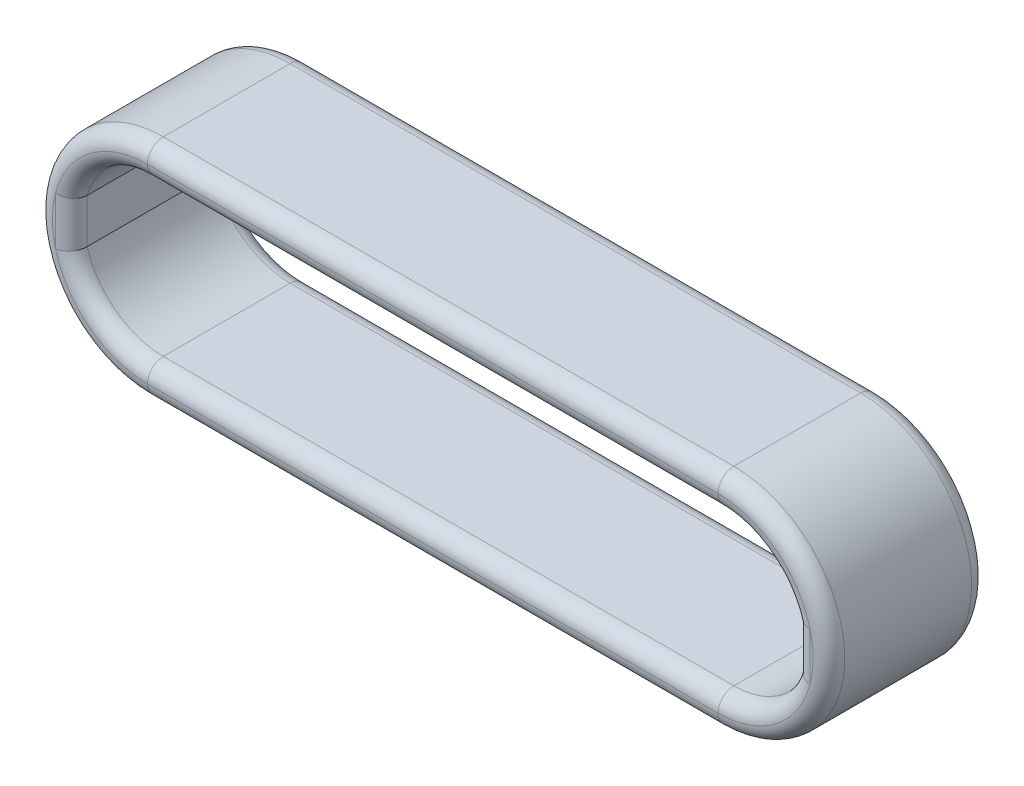
from build123d import *

# Parameters (mm, degrees)
BOSS_EXTRUDE1_DEPTH = 5
FILLET1_R           = 0.5


with BuildPart() as part:
    # Sketch1 → Boss-Extrude1 (new body)
    with BuildSketch(Plane.XY):
        with BuildLine():
            Line((-9, 3.5), (9, 3.5))
            ThreePointArc((9, 3.5), (12.5, 0), (9, -3.5))
            Line((9, -3.5), (-9, -3.5))
            ThreePointArc((-9, -3.5), (-12.5, 0), (-9, 3.5))
        make_face()
        with BuildLine():
            Line((-9, 2.5), (9, 2.5))
            ThreePointArc((9, 2.5), (10.5, 2), (11.4, 0.7))
            Line((11.4, 0.7), (11.4, -0.7))
            ThreePointArc((11.4, -0.7), (10.5, -2), (9, -2.5))
            Line((9, -2.5), (-9, -2.5))
            ThreePointArc((-9, -2.5), (-10.5, -2), (-11.4, -0.7))
            Line((-11.4, -0.7), (-11.4, 0.7))
            ThreePointArc((-11.4, 0.7), (-10.5, 2), (-9, 2.5))
        make_face(mode=Mode.SUBTRACT)
    extrude(amount=BOSS_EXTRUDE1_DEPTH)

    # Fillet1
    # the kernel refuses this fillet: 0.5 mm, written as the material it takes off along each edge
    with BuildSketch(Plane(origin=(9, 0, 5), x_dir=(0, 1, 0), z_dir=(-1, 0, 0))) as fillet1_piece_1:
        with BuildLine():
            CenterArc((3.5 - FILLET1_R, FILLET1_R), FILLET1_R, 270, 90)
            Line((3.5 - FILLET1_R, 0), (3.5, 0))
            Line((3.5, 0), (3.5, FILLET1_R))
        make_face()
    revolve(axis=Axis((9, 0, 5), (0, 0, -1)), revolution_arc=180, mode=Mode.SUBTRACT)
    with BuildSketch(Plane(origin=(-9, 3.5, 5), x_dir=(0, 0, -1), z_dir=(1, 0, 0)), Plane(origin=(9, -2.5, 0), x_dir=(0, 0, 1), z_dir=(-1, 0, 0)), Plane(origin=(-9, 2.5, 0), x_dir=(0, 0, 1), z_dir=(1, 0, 0)), Plane(origin=(9, -3.5, 5), x_dir=(0, 0, -1), z_dir=(-1, 0, 0))) as fillet1_piece_2:
        with BuildLine():
            CenterArc((FILLET1_R, -FILLET1_R), FILLET1_R, 90, 90)
            Line((0, -FILLET1_R), (0, 0))
            Line((0, 0), (FILLET1_R, 0))
        make_face()
    extrude(amount=18, mode=Mode.SUBTRACT)
    with BuildSketch(Plane(origin=(-9, 0, 0), x_dir=(-0.9766894786978908, -0.21465708048150275, 0), z_dir=(0.21465708048150275, -0.9766894786978908, 0))) as fillet1_piece_3_section:
        with BuildLine():
            CenterArc((2.5 + FILLET1_R, -FILLET1_R), FILLET1_R, 90, 90)
            Line((2.5 + FILLET1_R, 0), (2.5, 0))
            Line((2.5, 0), (2.5, -FILLET1_R))
        make_face()
    fillet1_piece_3 = revolve(axis=Axis((-9, 0, 0), (0, 0, -1)), revolution_arc=102.395409755, mode=Mode.PRIVATE)
    fillet1_piece_3 = split(fillet1_piece_3, bisect_by=Plane(origin=(-11.4, 2.113874097, 0.142342621), z_dir=(1, 0, 0)), keep=Keep.TOP, mode=Mode.PRIVATE)
    add(fillet1_piece_3, mode=Mode.SUBTRACT)
    with BuildSketch(Plane(origin=(-11.4, -1.95, 0), x_dir=(0, 0, 1), z_dir=(0, 1, 0))) as fillet1_piece_4_section:
        with BuildLine():
            CenterArc((FILLET1_R, -FILLET1_R), FILLET1_R, 90, 90)
            Line((0, -FILLET1_R), (0, 0))
            Line((0, 0), (FILLET1_R, 0))
        make_face()
    fillet1_piece_4 = extrude(amount=3.9, mode=Mode.PRIVATE)
    fillet1_piece_4 = fillet1_piece_4 & Plane(origin=(-9, 0, 0.177440654), x_dir=(-0.9599999999999995, 0.2800000000000019, 0), z_dir=(0, 0, -1)) * Cylinder(2.5, 10, mode=Mode.PRIVATE)
    add(fillet1_piece_4, mode=Mode.SUBTRACT)
    with BuildSketch(Plane(origin=(-9, 0, 0), x_dir=(0, -1, 0), z_dir=(1, 0, 0))) as fillet1_piece_5_section:
        with BuildLine():
            CenterArc((2.5 + FILLET1_R, -FILLET1_R), FILLET1_R, 90, 90)
            Line((2.5 + FILLET1_R, 0), (2.5, 0))
            Line((2.5, 0), (2.5, -FILLET1_R))
        make_face()
    fillet1_piece_5 = revolve(axis=Axis((-9, 0, 0), (0, 0, -1)), revolution_arc=102.395409755, mode=Mode.PRIVATE)
    fillet1_piece_5 = split(fillet1_piece_5, bisect_by=Plane(origin=(-11.4, -2.113874096, 0.14234262), z_dir=(1, 0, 0)), keep=Keep.TOP, mode=Mode.PRIVATE)
    add(fillet1_piece_5, mode=Mode.SUBTRACT)
    with BuildSketch(Plane(origin=(9, 0, 0), x_dir=(0.9766894786978914, 0.21465708048149984, 0), z_dir=(-0.21465708048149984, 0.9766894786978914, 0))) as fillet1_piece_6_section:
        with BuildLine():
            CenterArc((2.5 + FILLET1_R, -FILLET1_R), FILLET1_R, 90, 90)
            Line((2.5 + FILLET1_R, 0), (2.5, 0))
            Line((2.5, 0), (2.5, -FILLET1_R))
        make_face()
    fillet1_piece_6 = revolve(axis=Axis((9, 0, 0), (0, 0, -1)), revolution_arc=102.395409755, mode=Mode.PRIVATE)
    fillet1_piece_6 = split(fillet1_piece_6, bisect_by=Plane(origin=(11.4, -2.113874097, 0.142342621), z_dir=(-1, 0, 0)), keep=Keep.TOP, mode=Mode.PRIVATE)
    add(fillet1_piece_6, mode=Mode.SUBTRACT)
    with BuildSketch(Plane(origin=(11.4, 1.95, 0), x_dir=(0, 0, 1), z_dir=(0, -1, 0))) as fillet1_piece_7_section:
        with BuildLine():
            CenterArc((FILLET1_R, -FILLET1_R), FILLET1_R, 90, 90)
            Line((0, -FILLET1_R), (0, 0))
            Line((0, 0), (FILLET1_R, 0))
        make_face()
    fillet1_piece_7 = extrude(amount=3.9, mode=Mode.PRIVATE)
    fillet1_piece_7 = fillet1_piece_7 & Plane(origin=(9, 0, 0.177440654), x_dir=(0.9599999999999989, -0.2800000000000039, 0), z_dir=(0, 0, -1)) * Cylinder(2.5, 10, mode=Mode.PRIVATE)
    add(fillet1_piece_7, mode=Mode.SUBTRACT)
    with BuildSketch(Plane(origin=(9, 0, 0), x_dir=(0, 1, 0), z_dir=(-1, 0, 0))) as fillet1_piece_8_section:
        with BuildLine():
            CenterArc((2.5 + FILLET1_R, -FILLET1_R), FILLET1_R, 90, 90)
            Line((2.5 + FILLET1_R, 0), (2.5, 0))
            Line((2.5, 0), (2.5, -FILLET1_R))
        make_face()
    fillet1_piece_8 = revolve(axis=Axis((9, 0, 0), (0, 0, -1)), revolution_arc=102.395409755, mode=Mode.PRIVATE)
    fillet1_piece_8 = split(fillet1_piece_8, bisect_by=Plane(origin=(11.4, 2.113874096, 0.14234262), z_dir=(-1, 0, 0)), keep=Keep.TOP, mode=Mode.PRIVATE)
    add(fillet1_piece_8, mode=Mode.SUBTRACT)
    with BuildSketch(Plane(origin=(-9, 0, 5), x_dir=(-0.9766894786978908, -0.21465708048150275, 0), z_dir=(0.21465708048150275, -0.9766894786978908, 0))) as fillet1_piece_9_section:
        with BuildLine():
            CenterArc((2.5 + FILLET1_R, FILLET1_R), FILLET1_R, 180, 90)
            Line((2.5 + FILLET1_R, 0), (2.5, 0))
            Line((2.5, 0), (2.5, FILLET1_R))
        make_face()
    fillet1_piece_9 = revolve(axis=Axis((-9, 0, 5), (0, 0, -1)), revolution_arc=102.395409755, mode=Mode.PRIVATE)
    fillet1_piece_9 = split(fillet1_piece_9, bisect_by=Plane(origin=(-11.4, 2.113874097, 4.857657379), z_dir=(1, 0, 0)), keep=Keep.TOP, mode=Mode.PRIVATE)
    add(fillet1_piece_9, mode=Mode.SUBTRACT)
    with BuildSketch(Plane(origin=(-11.4, -1.95, 5), x_dir=(0, 0, -1), z_dir=(0, 1, 0))) as fillet1_piece_10_section:
        with BuildLine():
            CenterArc((FILLET1_R, FILLET1_R), FILLET1_R, 180, 90)
            Line((0, FILLET1_R), (0, 0))
            Line((0, 0), (FILLET1_R, 0))
        make_face()
    fillet1_piece_10 = extrude(amount=3.9, mode=Mode.PRIVATE)
    fillet1_piece_10 = fillet1_piece_10 & Plane(origin=(-9, 0, 4.822559346), x_dir=(-0.9599999999999995, 0.2800000000000019, 0), z_dir=(0, 0, -1)) * Cylinder(2.5, 10, mode=Mode.PRIVATE)
    add(fillet1_piece_10, mode=Mode.SUBTRACT)
    with BuildSketch(Plane(origin=(-9, 0, 5), x_dir=(0, -1, 0), z_dir=(1, 0, 0))) as fillet1_piece_11_section:
        with BuildLine():
            CenterArc((2.5 + FILLET1_R, FILLET1_R), FILLET1_R, 180, 90)
            Line((2.5 + FILLET1_R, 0), (2.5, 0))
            Line((2.5, 0), (2.5, FILLET1_R))
        make_face()
    fillet1_piece_11 = revolve(axis=Axis((-9, 0, 5), (0, 0, -1)), revolution_arc=102.395409755, mode=Mode.PRIVATE)
    fillet1_piece_11 = split(fillet1_piece_11, bisect_by=Plane(origin=(-11.4, -2.113874096, 4.85765738), z_dir=(1, 0, 0)), keep=Keep.TOP, mode=Mode.PRIVATE)
    add(fillet1_piece_11, mode=Mode.SUBTRACT)
    with BuildSketch(Plane(origin=(9, -2.5, 5), x_dir=(0, 0, -1), z_dir=(-1, 0, 0)), Plane(origin=(-9, 2.5, 5), x_dir=(0, 0, -1), z_dir=(1, 0, 0)), Plane(origin=(-9, 3.5, 0), x_dir=(0, 0, 1), z_dir=(1, 0, 0)), Plane(origin=(9, -3.5, 0), x_dir=(0, 0, 1), z_dir=(-1, 0, 0))) as fillet1_piece_12:
        with BuildLine():
            CenterArc((FILLET1_R, FILLET1_R), FILLET1_R, 180, 90)
            Line((0, FILLET1_R), (0, 0))
            Line((0, 0), (FILLET1_R, 0))
        make_face()
    extrude(amount=18, mode=Mode.SUBTRACT)
    with BuildSketch(Plane(origin=(9, 0, 5), x_dir=(0.9766894786978914, 0.21465708048150012, 0), z_dir=(-0.21465708048150012, 0.9766894786978914, 0))) as fillet1_piece_13_section:
        with BuildLine():
            CenterArc((2.5 + FILLET1_R, FILLET1_R), FILLET1_R, 180, 90)
            Line((2.5 + FILLET1_R, 0), (2.5, 0))
            Line((2.5, 0), (2.5, FILLET1_R))
        make_face()
    fillet1_piece_13 = revolve(axis=Axis((9, 0, 5), (0, 0, -1)), revolution_arc=102.395409755, mode=Mode.PRIVATE)
    fillet1_piece_13 = split(fillet1_piece_13, bisect_by=Plane(origin=(11.4, -2.113874097, 4.857657379), z_dir=(-1, 0, 0)), keep=Keep.TOP, mode=Mode.PRIVATE)
    add(fillet1_piece_13, mode=Mode.SUBTRACT)
    with BuildSketch(Plane(origin=(11.4, 1.95, 5), x_dir=(0, 0, -1), z_dir=(0, -1, 0))) as fillet1_piece_14_section:
        with BuildLine():
            CenterArc((FILLET1_R, FILLET1_R), FILLET1_R, 180, 90)
            Line((0, FILLET1_R), (0, 0))
            Line((0, 0), (FILLET1_R, 0))
        make_face()
    fillet1_piece_14 = extrude(amount=3.9, mode=Mode.PRIVATE)
    fillet1_piece_14 = fillet1_piece_14 & Plane(origin=(9, 0, 4.822559346), x_dir=(0.9599999999999989, -0.2800000000000039, 0), z_dir=(0, 0, -1)) * Cylinder(2.5, 10, mode=Mode.PRIVATE)
    add(fillet1_piece_14, mode=Mode.SUBTRACT)
    with BuildSketch(Plane(origin=(9, 0, 5), x_dir=(0, 1, 0), z_dir=(-1, 0, 0))) as fillet1_piece_15_section:
        with BuildLine():
            CenterArc((2.5 + FILLET1_R, FILLET1_R), FILLET1_R, 180, 90)
            Line((2.5 + FILLET1_R, 0), (2.5, 0))
            Line((2.5, 0), (2.5, FILLET1_R))
        make_face()
    fillet1_piece_15 = revolve(axis=Axis((9, 0, 5), (0, 0, -1)), revolution_arc=102.395409755, mode=Mode.PRIVATE)
    fillet1_piece_15 = split(fillet1_piece_15, bisect_by=Plane(origin=(11.4, 2.113874096, 4.85765738), z_dir=(-1, 0, 0)), keep=Keep.TOP, mode=Mode.PRIVATE)
    add(fillet1_piece_15, mode=Mode.SUBTRACT)
    with BuildSketch(Plane(origin=(-9, 0, 5), x_dir=(0, -1, 0), z_dir=(1, 0, 0))) as fillet1_piece_16:
        with BuildLine():
            CenterArc((3.5 - FILLET1_R, FILLET1_R), FILLET1_R, 270, 90)
            Line((3.5 - FILLET1_R, 0), (3.5, 0))
            Line((3.5, 0), (3.5, FILLET1_R))
        make_face()
    revolve(axis=Axis((-9, 0, 5), (0, 0, -1)), revolution_arc=180, mode=Mode.SUBTRACT)
    with BuildSketch(Plane(origin=(9, 0, 0), x_dir=(0, 1, 0), z_dir=(-1, 0, 0))) as fillet1_piece_17:
        with BuildLine():
            CenterArc((3.5 - FILLET1_R, -FILLET1_R), FILLET1_R, 0, 90)
            Line((3.5 - FILLET1_R, 0), (3.5, 0))
            Line((3.5, 0), (3.5, -FILLET1_R))
        make_face()
    revolve(axis=Axis((9, 0, 0), (0, 0, -1)), revolution_arc=180, mode=Mode.SUBTRACT)
    with BuildSketch(Plane(origin=(-9, 0, 0), x_dir=(0, -1, 0), z_dir=(1, 0, 0))) as fillet1_piece_18:
        with BuildLine():
            CenterArc((3.5 - FILLET1_R, -FILLET1_R), FILLET1_R, 0, 90)
            Line((3.5 - FILLET1_R, 0), (3.5, 0))
            Line((3.5, 0), (3.5, -FILLET1_R))
        make_face()
    revolve(axis=Axis((-9, 0, 0), (0, 0, -1)), revolution_arc=180, mode=Mode.SUBTRACT)
    with BuildSketch(Plane(origin=(-9, 0, 0), x_dir=(-0.9766894786978908, -0.21465708048150275, 0), z_dir=(0.21465708048150275, -0.9766894786978908, 0))) as fillet1_piece_19a_section:
        with BuildLine():
            CenterArc((2.5 + FILLET1_R, -FILLET1_R), FILLET1_R, 90, 90)
            Line((2.5 + FILLET1_R, 0), (2.5, 0))
            Line((2.5, 0), (2.5, -FILLET1_R))
        make_face()
    fillet1_piece_19a = revolve(axis=Axis((-9, 0, 0), (0, 0, -1)), revolution_arc=102.395409755, mode=Mode.PRIVATE)
    fillet1_piece_19a = split(fillet1_piece_19a, bisect_by=Plane(origin=(-11.4, 0.255268882, 0.100667664), z_dir=(-1, 0, 0)), keep=Keep.TOP, mode=Mode.PRIVATE)
    with BuildSketch(Plane(origin=(-11.4, -1.95, 0), x_dir=(0, 0, 1), z_dir=(0, 1, 0))) as fillet1_piece_19b_section:
        with BuildLine():
            CenterArc((FILLET1_R, -FILLET1_R), FILLET1_R, 90, 90)
            Line((0, -FILLET1_R), (0, 0))
            Line((0, 0), (FILLET1_R, 0))
        make_face()
    fillet1_piece_19b = extrude(amount=3.9, mode=Mode.PRIVATE)
    fillet1_piece_19b = fillet1_piece_19b - Plane(origin=(-9, 0, 0.101579773), x_dir=(-0.9599999999999995, 0.2800000000000019, 0), z_dir=(0, 0, -1)) * Cylinder(2.5, 10, mode=Mode.PRIVATE)
    fillet1_piece_19 = fillet1_piece_19a & fillet1_piece_19b
    add(fillet1_piece_19, mode=Mode.SUBTRACT)
    with BuildSketch(Plane(origin=(-11.4, -1.95, 0), x_dir=(0, 0, 1), z_dir=(0, 1, 0))) as fillet1_piece_20a_section:
        with BuildLine():
            CenterArc((FILLET1_R, -FILLET1_R), FILLET1_R, 90, 90)
            Line((0, -FILLET1_R), (0, 0))
            Line((0, 0), (FILLET1_R, 0))
        make_face()
    fillet1_piece_20a = extrude(amount=3.9, mode=Mode.PRIVATE)
    fillet1_piece_20a = fillet1_piece_20a - Plane(origin=(-9, 0, 0.101579773), x_dir=(-0.9599999999999995, 0.2800000000000019, 0), z_dir=(0, 0, -1)) * Cylinder(2.5, 10, mode=Mode.PRIVATE)
    with BuildSketch(Plane(origin=(-9, 0, 0), x_dir=(0, -1, 0), z_dir=(1, 0, 0))) as fillet1_piece_20b_section:
        with BuildLine():
            CenterArc((2.5 + FILLET1_R, -FILLET1_R), FILLET1_R, 90, 90)
            Line((2.5 + FILLET1_R, 0), (2.5, 0))
            Line((2.5, 0), (2.5, -FILLET1_R))
        make_face()
    fillet1_piece_20b = revolve(axis=Axis((-9, 0, 0), (0, 0, -1)), revolution_arc=102.395409755, mode=Mode.PRIVATE)
    fillet1_piece_20b = split(fillet1_piece_20b, bisect_by=Plane(origin=(-11.4, -0.255267344, 0.10066773), z_dir=(-1, 0, 0)), keep=Keep.TOP, mode=Mode.PRIVATE)
    fillet1_piece_20 = fillet1_piece_20a & fillet1_piece_20b
    add(fillet1_piece_20, mode=Mode.SUBTRACT)
    with BuildSketch(Plane(origin=(9, 0, 0), x_dir=(0.9766894786978914, 0.21465708048149984, 0), z_dir=(-0.21465708048149984, 0.9766894786978914, 0))) as fillet1_piece_21a_section:
        with BuildLine():
            CenterArc((2.5 + FILLET1_R, -FILLET1_R), FILLET1_R, 90, 90)
            Line((2.5 + FILLET1_R, 0), (2.5, 0))
            Line((2.5, 0), (2.5, -FILLET1_R))
        make_face()
    fillet1_piece_21a = revolve(axis=Axis((9, 0, 0), (0, 0, -1)), revolution_arc=102.395409755, mode=Mode.PRIVATE)
    fillet1_piece_21a = split(fillet1_piece_21a, bisect_by=Plane(origin=(11.4, -0.255268882, 0.100667664), z_dir=(1, 0, 0)), keep=Keep.TOP, mode=Mode.PRIVATE)
    with BuildSketch(Plane(origin=(11.4, 1.95, 0), x_dir=(0, 0, 1), z_dir=(0, -1, 0))) as fillet1_piece_21b_section:
        with BuildLine():
            CenterArc((FILLET1_R, -FILLET1_R), FILLET1_R, 90, 90)
            Line((0, -FILLET1_R), (0, 0))
            Line((0, 0), (FILLET1_R, 0))
        make_face()
    fillet1_piece_21b = extrude(amount=3.9, mode=Mode.PRIVATE)
    fillet1_piece_21b = fillet1_piece_21b - Plane(origin=(9, 0, 0.101579773), x_dir=(0.9599999999999989, -0.2800000000000039, 0), z_dir=(0, 0, -1)) * Cylinder(2.5, 10, mode=Mode.PRIVATE)
    fillet1_piece_21 = fillet1_piece_21a & fillet1_piece_21b
    add(fillet1_piece_21, mode=Mode.SUBTRACT)
    with BuildSketch(Plane(origin=(11.4, 1.95, 0), x_dir=(0, 0, 1), z_dir=(0, -1, 0))) as fillet1_piece_22a_section:
        with BuildLine():
            CenterArc((FILLET1_R, -FILLET1_R), FILLET1_R, 90, 90)
            Line((0, -FILLET1_R), (0, 0))
            Line((0, 0), (FILLET1_R, 0))
        make_face()
    fillet1_piece_22a = extrude(amount=3.9, mode=Mode.PRIVATE)
    fillet1_piece_22a = fillet1_piece_22a - Plane(origin=(9, 0, 0.101579773), x_dir=(0.9599999999999989, -0.2800000000000039, 0), z_dir=(0, 0, -1)) * Cylinder(2.5, 10, mode=Mode.PRIVATE)
    with BuildSketch(Plane(origin=(9, 0, 0), x_dir=(0, 1, 0), z_dir=(-1, 0, 0))) as fillet1_piece_22b_section:
        with BuildLine():
            CenterArc((2.5 + FILLET1_R, -FILLET1_R), FILLET1_R, 90, 90)
            Line((2.5 + FILLET1_R, 0), (2.5, 0))
            Line((2.5, 0), (2.5, -FILLET1_R))
        make_face()
    fillet1_piece_22b = revolve(axis=Axis((9, 0, 0), (0, 0, -1)), revolution_arc=102.395409755, mode=Mode.PRIVATE)
    fillet1_piece_22b = split(fillet1_piece_22b, bisect_by=Plane(origin=(11.4, 0.255267344, 0.10066773), z_dir=(1, 0, 0)), keep=Keep.TOP, mode=Mode.PRIVATE)
    fillet1_piece_22 = fillet1_piece_22a & fillet1_piece_22b
    add(fillet1_piece_22, mode=Mode.SUBTRACT)
    with BuildSketch(Plane(origin=(-9, 0, 5), x_dir=(-0.9766894786978908, -0.21465708048150275, 0), z_dir=(0.21465708048150275, -0.9766894786978908, 0))) as fillet1_piece_23a_section:
        with BuildLine():
            CenterArc((2.5 + FILLET1_R, FILLET1_R), FILLET1_R, 180, 90)
            Line((2.5 + FILLET1_R, 0), (2.5, 0))
            Line((2.5, 0), (2.5, FILLET1_R))
        make_face()
    fillet1_piece_23a = revolve(axis=Axis((-9, 0, 5), (0, 0, -1)), revolution_arc=102.395409755, mode=Mode.PRIVATE)
    fillet1_piece_23a = split(fillet1_piece_23a, bisect_by=Plane(origin=(-11.4, 0.255268882, 4.899332336), z_dir=(-1, 0, 0)), keep=Keep.TOP, mode=Mode.PRIVATE)
    with BuildSketch(Plane(origin=(-11.4, -1.95, 5), x_dir=(0, 0, -1), z_dir=(0, 1, 0))) as fillet1_piece_23b_section:
        with BuildLine():
            CenterArc((FILLET1_R, FILLET1_R), FILLET1_R, 180, 90)
            Line((0, FILLET1_R), (0, 0))
            Line((0, 0), (FILLET1_R, 0))
        make_face()
    fillet1_piece_23b = extrude(amount=3.9, mode=Mode.PRIVATE)
    fillet1_piece_23b = fillet1_piece_23b - Plane(origin=(-9, 0, 4.898420227), x_dir=(-0.9599999999999995, 0.2800000000000019, 0), z_dir=(0, 0, -1)) * Cylinder(2.5, 10, mode=Mode.PRIVATE)
    fillet1_piece_23 = fillet1_piece_23a & fillet1_piece_23b
    add(fillet1_piece_23, mode=Mode.SUBTRACT)
    with BuildSketch(Plane(origin=(-11.4, -1.95, 5), x_dir=(0, 0, -1), z_dir=(0, 1, 0))) as fillet1_piece_24a_section:
        with BuildLine():
            CenterArc((FILLET1_R, FILLET1_R), FILLET1_R, 180, 90)
            Line((0, FILLET1_R), (0, 0))
            Line((0, 0), (FILLET1_R, 0))
        make_face()
    fillet1_piece_24a = extrude(amount=3.9, mode=Mode.PRIVATE)
    fillet1_piece_24a = fillet1_piece_24a - Plane(origin=(-9, 0, 4.898420227), x_dir=(-0.9599999999999995, 0.2800000000000019, 0), z_dir=(0, 0, -1)) * Cylinder(2.5, 10, mode=Mode.PRIVATE)
    with BuildSketch(Plane(origin=(-9, 0, 5), x_dir=(0, -1, 0), z_dir=(1, 0, 0))) as fillet1_piece_24b_section:
        with BuildLine():
            CenterArc((2.5 + FILLET1_R, FILLET1_R), FILLET1_R, 180, 90)
            Line((2.5 + FILLET1_R, 0), (2.5, 0))
            Line((2.5, 0), (2.5, FILLET1_R))
        make_face()
    fillet1_piece_24b = revolve(axis=Axis((-9, 0, 5), (0, 0, -1)), revolution_arc=102.395409755, mode=Mode.PRIVATE)
    fillet1_piece_24b = split(fillet1_piece_24b, bisect_by=Plane(origin=(-11.4, -0.255267344, 4.89933227), z_dir=(-1, 0, 0)), keep=Keep.TOP, mode=Mode.PRIVATE)
    fillet1_piece_24 = fillet1_piece_24a & fillet1_piece_24b
    add(fillet1_piece_24, mode=Mode.SUBTRACT)
    with BuildSketch(Plane(origin=(9, 0, 5), x_dir=(0.9766894786978914, 0.21465708048150012, 0), z_dir=(-0.21465708048150012, 0.9766894786978914, 0))) as fillet1_piece_25a_section:
        with BuildLine():
            CenterArc((2.5 + FILLET1_R, FILLET1_R), FILLET1_R, 180, 90)
            Line((2.5 + FILLET1_R, 0), (2.5, 0))
            Line((2.5, 0), (2.5, FILLET1_R))
        make_face()
    fillet1_piece_25a = revolve(axis=Axis((9, 0, 5), (0, 0, -1)), revolution_arc=102.395409755, mode=Mode.PRIVATE)
    fillet1_piece_25a = split(fillet1_piece_25a, bisect_by=Plane(origin=(11.4, -0.255268882, 4.899332336), z_dir=(1, 0, 0)), keep=Keep.TOP, mode=Mode.PRIVATE)
    with BuildSketch(Plane(origin=(11.4, 1.95, 5), x_dir=(0, 0, -1), z_dir=(0, -1, 0))) as fillet1_piece_25b_section:
        with BuildLine():
            CenterArc((FILLET1_R, FILLET1_R), FILLET1_R, 180, 90)
            Line((0, FILLET1_R), (0, 0))
            Line((0, 0), (FILLET1_R, 0))
        make_face()
    fillet1_piece_25b = extrude(amount=3.9, mode=Mode.PRIVATE)
    fillet1_piece_25b = fillet1_piece_25b - Plane(origin=(9, 0, 4.898420227), x_dir=(0.9599999999999989, -0.2800000000000039, 0), z_dir=(0, 0, -1)) * Cylinder(2.5, 10, mode=Mode.PRIVATE)
    fillet1_piece_25 = fillet1_piece_25a & fillet1_piece_25b
    add(fillet1_piece_25, mode=Mode.SUBTRACT)
    with BuildSketch(Plane(origin=(11.4, 1.95, 5), x_dir=(0, 0, -1), z_dir=(0, -1, 0))) as fillet1_piece_26a_section:
        with BuildLine():
            CenterArc((FILLET1_R, FILLET1_R), FILLET1_R, 180, 90)
            Line((0, FILLET1_R), (0, 0))
            Line((0, 0), (FILLET1_R, 0))
        make_face()
    fillet1_piece_26a = extrude(amount=3.9, mode=Mode.PRIVATE)
    fillet1_piece_26a = fillet1_piece_26a - Plane(origin=(9, 0, 4.898420227), x_dir=(0.9599999999999989, -0.2800000000000039, 0), z_dir=(0, 0, -1)) * Cylinder(2.5, 10, mode=Mode.PRIVATE)
    with BuildSketch(Plane(origin=(9, 0, 5), x_dir=(0, 1, 0), z_dir=(-1, 0, 0))) as fillet1_piece_26b_section:
        with BuildLine():
            CenterArc((2.5 + FILLET1_R, FILLET1_R), FILLET1_R, 180, 90)
            Line((2.5 + FILLET1_R, 0), (2.5, 0))
            Line((2.5, 0), (2.5, FILLET1_R))
        make_face()
    fillet1_piece_26b = revolve(axis=Axis((9, 0, 5), (0, 0, -1)), revolution_arc=102.395409755, mode=Mode.PRIVATE)
    fillet1_piece_26b = split(fillet1_piece_26b, bisect_by=Plane(origin=(11.4, 0.255267344, 4.89933227), z_dir=(1, 0, 0)), keep=Keep.TOP, mode=Mode.PRIVATE)
    fillet1_piece_26 = fillet1_piece_26a & fillet1_piece_26b
    add(fillet1_piece_26, mode=Mode.SUBTRACT)


solid = part.part
